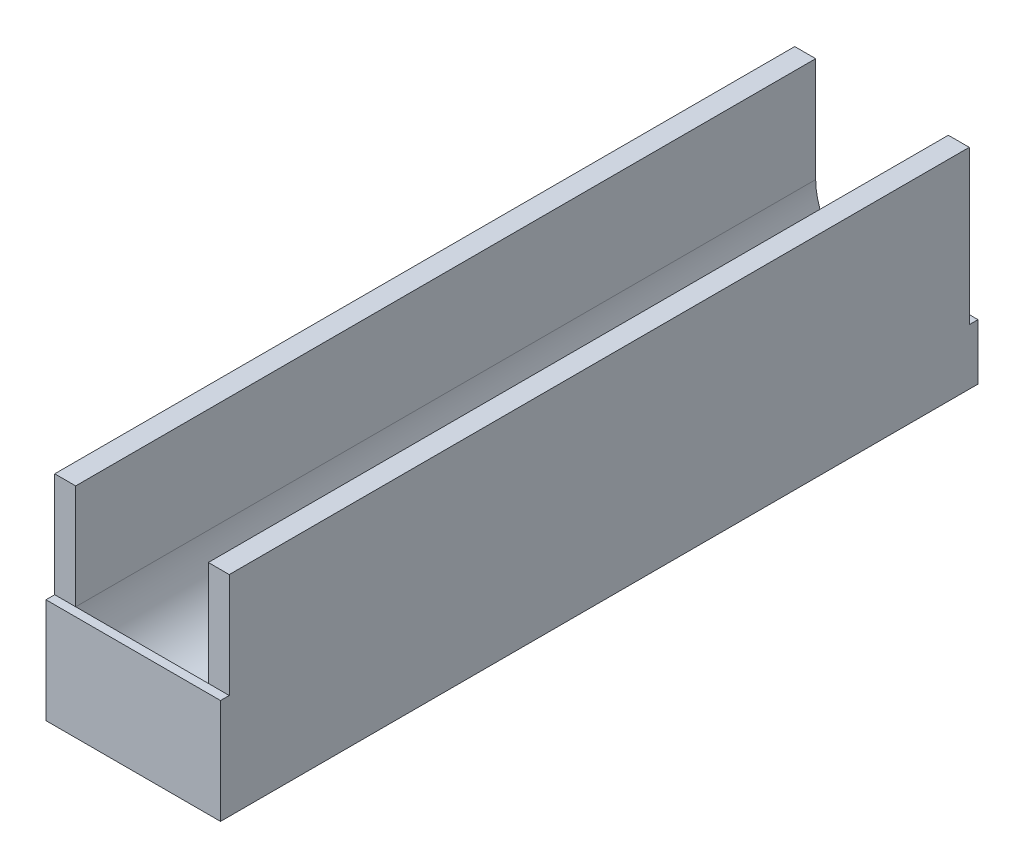
from build123d import *

# Parameters (mm, degrees)
SKETCH1_W           = 31.75
SKETCH1_H           = 38.1
BOSS_EXTRUDE1_DEPTH = 134.62
CUT_EXTRUDE1_DEPTH  = 141.805433223
SKETCH3_R           = 2
CUT_EXTRUDE2_DEPTH  = 7
SKETCH4_W           = 31.75
SKETCH4_H           = 19.05
BOSS_EXTRUDE2_DEPTH = 1.5875
SKETCH5_W           = 31.75
SKETCH5_H           = 10.16
BOSS_EXTRUDE3_DEPTH = 1.5875


with BuildPart() as part:
    # Sketch1 → Boss-Extrude1 (new body)
    with BuildSketch(Plane.XY):
        with Locations((0, 19.05)):
            Rectangle(SKETCH1_W, SKETCH1_H)
    extrude(amount=BOSS_EXTRUDE1_DEPTH)

    # Sketch2 → Cut-Extrude1 (cut, through all)
    with BuildSketch(Plane.XY.offset(134.62)):
        with BuildLine():
            Line((-12.065, 19.05), (-12.065, 38.1))
            Line((-12.065, 38.1), (12.065, 38.1))
            Line((12.065, 38.1), (12.065, 19.05))
            ThreePointArc((12.065, 19.05), (0, 6.985), (-12.065, 19.05))
        make_face()
    extrude(amount=-CUT_EXTRUDE1_DEPTH, mode=Mode.SUBTRACT)

    # Sketch3 → Cut-Extrude2 (cut)
    with BuildSketch(Plane.XZ):
        with Locations((-12.7, 128.27)):
            Circle(SKETCH3_R)
        with Locations((12.7, 6.35)):
            Circle(SKETCH3_R)
    extrude(amount=-CUT_EXTRUDE2_DEPTH, mode=Mode.SUBTRACT)

    # Sketch4 → Boss-Extrude2 (add)
    with BuildSketch(Plane.XY.offset(134.62)):
        with Locations((0, 9.525)):
            Rectangle(SKETCH4_W, SKETCH4_H)
    extrude(amount=BOSS_EXTRUDE2_DEPTH)

    # Sketch5 → Boss-Extrude3 (add)
    with BuildSketch(Plane(origin=(0, 0, 0), x_dir=(-1, 0, 0), z_dir=(0, 0, -1))):
        with Locations((0, 5.08)):
            Rectangle(SKETCH5_W, SKETCH5_H)
    extrude(amount=BOSS_EXTRUDE3_DEPTH)


solid = part.part
